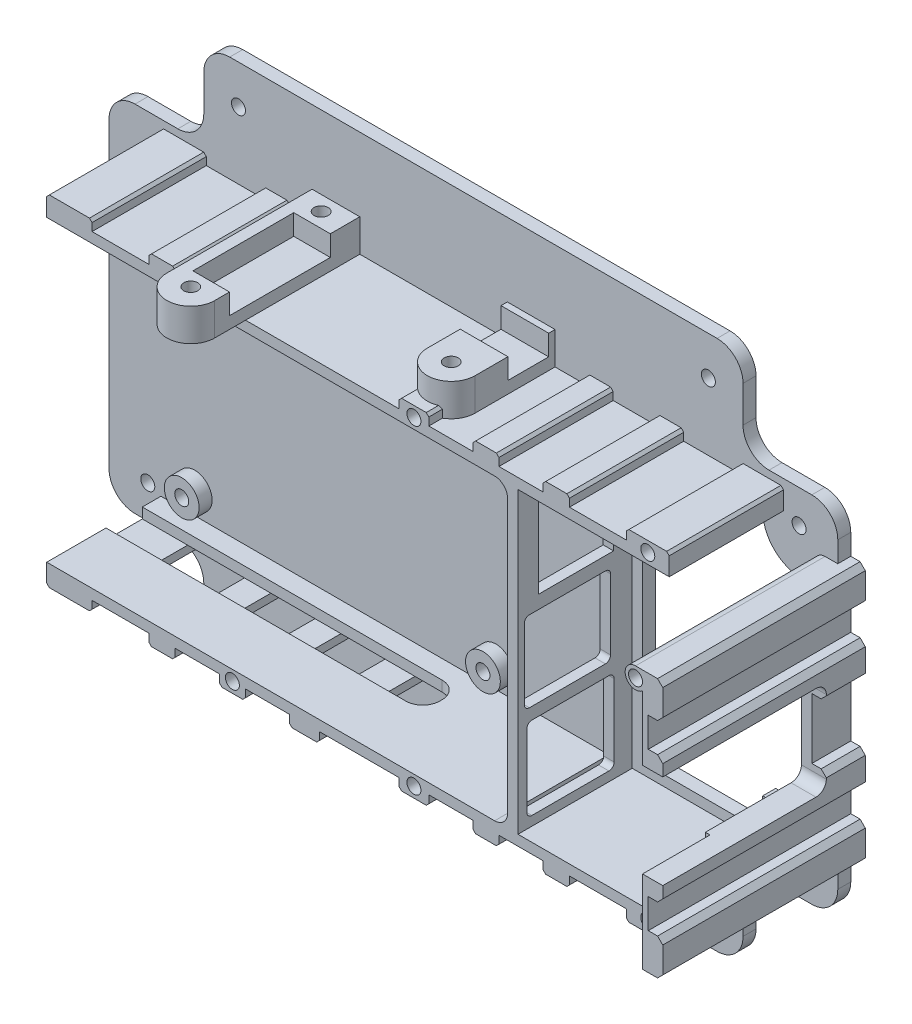
from build123d import *
from build123d.topology import SkipClean

# Parameters (mm, degrees)
SKETCH1_R            = 1.35
BOSS_EXTRUDE1_DEPTH  = 2.5
SKETCH3_R            = 3.35
SKETCH3_R_2          = 1.35
BOSS_EXTRUDE3_DEPTH  = 2.5
CUT_EXTRUDE1_START   = -2.5
SKETCH4_R            = 1.35
CUT_EXTRUDE1_DEPTH   = 2.5
BOSS_EXTRUDE4_DEPTH  = 22
SKETCH6_W            = 14.5
SKETCH6_H            = 16.9
CUT_EXTRUDE2_DEPTH   = 2
CUT_EXTRUDE3_DEPTH   = 2
BOSS_EXTRUDE6_REACH  = 91.556
BOSS_EXTRUDE7_DEPTH  = 1.5
BOSS_EXTRUDE8_DEPTH  = 13
SKETCH12_R           = 1.35
CUT_EXTRUDE4_DEPTH   = 3
SKETCH15_R           = 1.35
BOSS_EXTRUDE9_DEPTH  = 6.25
SKETCH16_W           = 7.045336579
SKETCH16_H           = 19.415
SKETCH16_W_2         = 9.190673157
SKETCH16_H_2         = 7.85
CUT_EXTRUDE5_DEPTH   = 5
SKETCH17_R           = 1.35
CUT_EXTRUDE6_DEPTH   = 3
BOSS_EXTRUDE11_DEPTH = 39
SKETCH19_R           = 1.35
CUT_EXTRUDE8_DEPTH   = 2
CUT_EXTRUDE9_DEPTH   = 2.5
SKETCH22_W           = 8.503871067
SKETCH22_H           = 18.115334786
CUT_EXTRUDE11_DEPTH  = 31.5
FILLET1_R            = 2


with BuildPart() as part:
    # Sketch1 → Boss-Extrude1 (new body)
    with BuildSketch(Plane.XY):
        with BuildLine():
            Line((-70.166987996, -29.147315073), (-70.166987996, 29.147315073))
            ThreePointArc((-70.166987996, 29.147315073), (-68.702521902, 32.682848979), (-65.166987996, 34.147315073))
            Line((-65.166987996, 34.147315073), (-56.919821216, 34.147315073))
            ThreePointArc((-56.919821216, 34.147315073), (-53.38428731, 35.611781167), (-51.919821216, 39.147315073))
            Line((-51.919821216, 39.147315073), (-51.919821216, 46.116987996))
            ThreePointArc((-51.919821216, 46.116987996), (-50.455355122, 49.652521902), (-46.919821216, 51.116987996))
            Line((-46.919821216, 51.116987996), (46.919821216, 51.116987996))
            ThreePointArc((46.919821216, 51.116987996), (50.455355122, 49.652521902), (51.919821216, 46.116987996))
            Line((51.919821216, 46.116987996), (51.919821216, 39.147315073))
            ThreePointArc((51.919821216, 39.147315073), (53.38428731, 35.611781167), (56.919821216, 34.147315073))
            Line((56.919821216, 34.147315073), (65.166987996, 34.147315073))
            ThreePointArc((65.166987996, 34.147315073), (68.702521902, 32.682848979), (70.166987996, 29.147315073))
            Line((70.166987996, 29.147315073), (70.166987996, -29.147315073))
            ThreePointArc((70.166987996, -29.147315073), (68.702521902, -32.682848979), (65.166987996, -34.147315073))
            Line((65.166987996, -34.147315073), (56.919821216, -34.147315073))
            ThreePointArc((56.919821216, -34.147315073), (53.38428731, -35.611781167), (51.919821216, -39.147315073))
            Line((51.919821216, -39.147315073), (51.919821216, -46.116987996))
            ThreePointArc((51.919821216, -46.116987996), (50.455355122, -49.652521902), (46.919821216, -51.116987996))
            Line((46.919821216, -51.116987996), (-46.919821216, -51.116987996))
            ThreePointArc((-46.919821216, -51.116987996), (-50.455355122, -49.652521902), (-51.919821216, -46.116987996))
            Line((-51.919821216, -46.116987996), (-51.919821216, -39.147315073))
            ThreePointArc((-51.919821216, -39.147315073), (-53.38428731, -35.611781167), (-56.919821216, -34.147315073))
            Line((-56.919821216, -34.147315073), (-65.166987996, -34.147315073))
            ThreePointArc((-65.166987996, -34.147315073), (-68.702521902, -32.682848979), (-70.166987996, -29.147315073))
        make_face()
        with Locations((-62.70625, -27.78125)):
            Circle(SKETCH1_R, mode=Mode.SUBTRACT)
        with Locations((-45.24375, -43.65625)):
            Circle(SKETCH1_R, mode=Mode.SUBTRACT)
        with Locations((45.24375, -43.65625)):
            Circle(SKETCH1_R, mode=Mode.SUBTRACT)
        with Locations((62.70625, -27.78125)):
            Circle(SKETCH1_R, mode=Mode.SUBTRACT)
        with Locations((62.70625, 27.78125)):
            Circle(SKETCH1_R, mode=Mode.SUBTRACT)
        with Locations((45.24375, 43.65625)):
            Circle(SKETCH1_R, mode=Mode.SUBTRACT)
        with Locations((-45.24375, 43.65625)):
            Circle(SKETCH1_R, mode=Mode.SUBTRACT)
        with Locations((-62.70625, 27.78125)):
            Circle(SKETCH1_R, mode=Mode.SUBTRACT)
    extrude(amount=BOSS_EXTRUDE1_DEPTH)

    # Sketch3 → Boss-Extrude3 (add)
    # profile 1 of 4: a face of its own
    with BuildSketch(Plane.XY.offset(2.5)):
        with Locations(Location((-53.666987996, 24.5, 0), (0, 0, 180))):
            Circle(SKETCH3_R)
        with Locations((-53.666987996, 24.5)):
            Circle(SKETCH3_R_2, mode=Mode.SUBTRACT)
    # profile 2 of 4: a face of its own
    with BuildSketch(Plane.XY.offset(2.5)):
        with Locations(Location((-53.666987996, -24.5, 0), (0, 0, 180))):
            Circle(SKETCH3_R)
        with Locations((-53.666987996, -24.5)):
            Circle(SKETCH3_R_2, mode=Mode.SUBTRACT)
    # profile 3 of 4: a face of its own
    with BuildSketch(Plane.XY.offset(2.5)):
        with Locations(Location((4.333012004, -24.5, 0), (0, 0, 180))):
            Circle(SKETCH3_R)
        with Locations((4.333012004, -24.5)):
            Circle(SKETCH3_R_2, mode=Mode.SUBTRACT)
    # profile 4 of 4: a face of its own
    with BuildSketch(Plane.XY.offset(2.5)):
        with Locations(Location((4.333012004, 24.5, 0), (0, 0, 180))):
            Circle(SKETCH3_R)
        with Locations((4.333012004, 24.5)):
            Circle(SKETCH3_R_2, mode=Mode.SUBTRACT)
    extrude(amount=BOSS_EXTRUDE3_DEPTH)

    # Sketch4 → Cut-Extrude1 (cut)
    with BuildSketch(Plane.XY.offset(2.5).offset(CUT_EXTRUDE1_START)):
        with Locations(Location((-53.666987996, 24.5, 0), (0, 0, 180))):
            Circle(SKETCH4_R)
        with Locations(Location((4.333012004, 24.5, 0), (0, 0, 180))):
            Circle(SKETCH4_R)
        with Locations(Location((-53.666987996, -24.5, 0), (0, 0, 180))):
            Circle(SKETCH4_R)
        with Locations(Location((4.333012004, -24.5, 0), (0, 0, 180))):
            Circle(SKETCH4_R)
    extrude(amount=CUT_EXTRUDE1_DEPTH, mode=Mode.SUBTRACT)

    # Sketch5 → Boss-Extrude4 (add)
    with BuildSketch(Plane.XY.offset(2.5)):
        with BuildLine():
            Line((-60.166987996, 28.75), (26.083012004, 28.75))
            ThreePointArc((26.083012004, 28.75), (27.850778957, 28.017766953), (28.583012004, 26.25))
            Line((28.583012004, 26.25), (28.583012004, -26.25))
            ThreePointArc((28.583012004, -26.25), (27.850778957, -28.017766953), (26.083012004, -28.75))
            Line((26.083012004, -28.75), (-60.166987996, -28.75))
            Line((-60.166987996, -28.75), (-60.166987996, -30.75))
            Line((-60.166987996, -30.75), (28.083012004, -30.75))
            Line((28.083012004, -30.75), (59.70625, -30.75))
            Line((59.70625, -30.75), (59.70625, -24.78125))
            Line((59.70625, -24.78125), (70.166987996, -24.78125))
            Line((70.166987996, -24.78125), (70.166987996, 25.15))
            Line((70.166987996, 25.15), (67.716987996, 25.15))
            ThreePointArc((67.716987996, 25.15), (65.729849972, 22.923543662), (68.166987996, 21.201282473))
            Line((68.166987996, 21.201282473), (68.166987996, -22.78125))
            Line((68.166987996, -22.78125), (57.70625, -22.78125))
            Line((57.70625, -22.78125), (57.70625, -28.75))
            Line((57.70625, -28.75), (30.583012004, -28.75))
            Line((30.583012004, -28.75), (30.583012004, 28.75))
            Line((30.583012004, 28.75), (59.70625, 28.75))
            Line((59.70625, 28.75), (59.70625, 30.75))
            Line((59.70625, 30.75), (28.083012004, 30.75))
            Line((28.083012004, 30.75), (-60.166987996, 30.75))
            Line((-60.166987996, 30.75), (-60.166987996, 28.75))
        make_face()
    extrude(amount=BOSS_EXTRUDE4_DEPTH)

    # Sketch6 → Cut-Extrude2 (cut)
    with BuildSketch(Plane(origin=(30.583012004, 0, 0), x_dir=(0, 0, -1), z_dir=(1, 0, 0))):
        with BuildLine():
            Line((-6.99, -11.05), (-21.81, -11.05))
            ThreePointArc((-21.81, -11.05), (-22.517106781, -11.342893219), (-22.81, -12.05))
            Line((-22.81, -12.05), (-22.81, -25.95))
            ThreePointArc((-22.81, -25.95), (-22.517106781, -26.657106781), (-21.81, -26.95))
            Line((-21.81, -26.95), (-6.99, -26.95))
            ThreePointArc((-6.99, -26.95), (-6.282893219, -26.657106781), (-5.99, -25.95))
            Line((-5.99, -25.95), (-5.99, -12.05))
            ThreePointArc((-5.99, -12.05), (-6.282893219, -11.342893219), (-6.99, -11.05))
        make_face()
        with BuildLine():
            Line((-22.29, -8.75), (-7.67, -8.75))
            ThreePointArc((-7.67, -8.75), (-6.962893219, -8.457106781), (-6.67, -7.75))
            Line((-6.67, -7.75), (-6.67, 5.75))
            ThreePointArc((-6.67, 5.75), (-6.962893219, 6.457106781), (-7.67, 6.75))
            Line((-7.67, 6.75), (-22.29, 6.75))
            ThreePointArc((-22.29, 6.75), (-22.997106781, 6.457106781), (-23.29, 5.75))
            Line((-23.29, 5.75), (-23.29, -7.75))
            ThreePointArc((-23.29, -7.75), (-22.997106781, -8.457106781), (-22.29, -8.75))
        make_face()
        with Locations((-13.34, 17.75)):
            Rectangle(SKETCH6_W, SKETCH6_H)
    extrude(amount=-CUT_EXTRUDE2_DEPTH, mode=Mode.SUBTRACT)

    # Sketch8 → Cut-Extrude3 (cut)
    with BuildSketch(Plane.XZ.offset(30.75)):
        with BuildLine():
            Line((-60.166987996, 13.09), (-2.416987996, 13.09))
            ThreePointArc((-2.416987996, 13.09), (-0.118890957, 12.138097039), (0.833012004, 9.84))
            Line((0.833012004, 9.84), (0.833012004, 9.34))
            ThreePointArc((0.833012004, 9.34), (-0.118890957, 7.041902961), (-2.416987996, 6.09))
            Line((-2.416987996, 6.09), (-60.166987996, 6.09))
            Line((-60.166987996, 6.09), (-60.166987996, 13.09))
        make_face()
    extrude(amount=-CUT_EXTRUDE3_DEPTH, mode=Mode.SUBTRACT)

    # Boss-Extrude6: up to this face of the body (flat: up to its plane)
    boss_extrude6_end = Plane(part.part.faces().sort_by_distance((69.608140149, -0.789983763, 24.5))[0])
    # Sketch9 → Boss-Extrude6 (add, up to the picked face)
    with BuildSketch(Plane.XY.offset(2.5), mode=Mode.PRIVATE) as boss_extrude6_sk1:
        Polygon((-40.496987996, -30.75), (-35.416987996, -30.75), (-35.416987996, -32.25), (-35.916987996, -32.75), (-39.996987996, -32.75), (-40.496987996, -32.25), align=None)
    boss_extrude6_tool1 = split(extrude(boss_extrude6_sk1.sketch, amount=BOSS_EXTRUDE6_REACH, mode=Mode.PRIVATE), bisect_by=boss_extrude6_end, keep=Keep.BOTH, mode=Mode.PRIVATE)
    # Sketch9 → Boss-Extrude6 (add, up to the picked face)
    with BuildSketch(Plane.XY.offset(2.5), mode=Mode.PRIVATE) as boss_extrude6_sk2:
        Polygon((-26.916987996, -30.75), (-21.916987996, -30.75), (-21.916987996, -32.25), (-22.416987996, -32.75), (-26.416987996, -32.75), (-26.916987996, -32.25), align=None)
    boss_extrude6_tool2 = split(extrude(boss_extrude6_sk2.sketch, amount=BOSS_EXTRUDE6_REACH, mode=Mode.PRIVATE), bisect_by=boss_extrude6_end, keep=Keep.BOTH, mode=Mode.PRIVATE)
    # Sketch9 → Boss-Extrude6 (add, up to the picked face)
    with BuildSketch(Plane.XY.offset(2.5), mode=Mode.PRIVATE) as boss_extrude6_sk3:
        Polygon((-13.416987996, -30.75), (-7.666987996, -30.75), (-7.666987996, -32.25), (-8.166987996, -32.75), (-12.916987996, -32.75), (-13.416987996, -32.25), align=None)
    boss_extrude6_tool3 = split(extrude(boss_extrude6_sk3.sketch, amount=BOSS_EXTRUDE6_REACH, mode=Mode.PRIVATE), bisect_by=boss_extrude6_end, keep=Keep.BOTH, mode=Mode.PRIVATE)
    # Sketch9 → Boss-Extrude6 (add, up to the picked face)
    with BuildSketch(Plane.XY.offset(2.5), mode=Mode.PRIVATE) as boss_extrude6_sk4:
        Polygon((-51.436987996, -30.75), (-60.163932929, -30.75), (-60.163932929, -32.25), (-59.663932929, -32.75), (-51.936987996, -32.75), (-51.436987996, -32.25), align=None)
    boss_extrude6_tool4 = split(extrude(boss_extrude6_sk4.sketch, amount=BOSS_EXTRUDE6_REACH, mode=Mode.PRIVATE), bisect_by=boss_extrude6_end, keep=Keep.BOTH, mode=Mode.PRIVATE)
    # Sketch9 → Boss-Extrude6 (add, up to the picked face)
    with BuildSketch(Plane.XY.offset(2.5), mode=Mode.PRIVATE) as boss_extrude6_sk5:
        Polygon((-26.416987996, 32.75), (-22.416987996, 32.75), (-21.916987996, 32.25), (-21.916987996, 30.75), (-26.916987996, 30.75), (-26.916987996, 32.25), align=None)
    boss_extrude6_tool5 = split(extrude(boss_extrude6_sk5.sketch, amount=BOSS_EXTRUDE6_REACH, mode=Mode.PRIVATE), bisect_by=boss_extrude6_end, keep=Keep.BOTH, mode=Mode.PRIVATE)
    # Sketch9 → Boss-Extrude6 (add, up to the picked face)
    with BuildSketch(Plane.XY.offset(2.5), mode=Mode.PRIVATE) as boss_extrude6_sk6:
        Polygon((-39.996987996, 32.75), (-35.916987996, 32.75), (-35.416987996, 32.25), (-35.416987996, 30.75), (-40.496987996, 30.75), (-40.496987996, 32.25), align=None)
    boss_extrude6_tool6 = split(extrude(boss_extrude6_sk6.sketch, amount=BOSS_EXTRUDE6_REACH, mode=Mode.PRIVATE), bisect_by=boss_extrude6_end, keep=Keep.BOTH, mode=Mode.PRIVATE)
    # Sketch9 → Boss-Extrude6 (add, up to the picked face)
    with BuildSketch(Plane.XY.offset(2.5), mode=Mode.PRIVATE) as boss_extrude6_sk7:
        Polygon((-51.936987996, 32.75), (-59.663932929, 32.75), (-60.163932929, 32.25), (-60.163932929, 30.75), (-51.436987996, 30.75), (-51.436987996, 32.25), align=None)
    boss_extrude6_tool7 = split(extrude(boss_extrude6_sk7.sketch, amount=BOSS_EXTRUDE6_REACH, mode=Mode.PRIVATE), bisect_by=boss_extrude6_end, keep=Keep.BOTH, mode=Mode.PRIVATE)
    # Sketch9 → Boss-Extrude6 (add, up to the picked face)
    with BuildSketch(Plane.XY.offset(2.5), mode=Mode.PRIVATE) as boss_extrude6_sk8:
        Polygon((51.436987996, 32.25), (51.936987996, 32.75), (59.20625, 32.75), (59.70625, 32.25), (59.70625, 30.75), (51.436987996, 30.75), align=None)
    boss_extrude6_tool8 = split(extrude(boss_extrude6_sk8.sketch, amount=BOSS_EXTRUDE6_REACH, mode=Mode.PRIVATE), bisect_by=boss_extrude6_end, keep=Keep.BOTH, mode=Mode.PRIVATE)
    # Sketch9 → Boss-Extrude6 (add, up to the picked face)
    with BuildSketch(Plane.XY.offset(2.5), mode=Mode.PRIVATE) as boss_extrude6_sk9:
        Polygon((40.496987996, 32.25), (39.996987996, 32.75), (35.916987996, 32.75), (35.416987996, 32.25), (35.416987996, 30.75), (40.496987996, 30.75), align=None)
    boss_extrude6_tool9 = split(extrude(boss_extrude6_sk9.sketch, amount=BOSS_EXTRUDE6_REACH, mode=Mode.PRIVATE), bisect_by=boss_extrude6_end, keep=Keep.BOTH, mode=Mode.PRIVATE)
    # Sketch9 → Boss-Extrude6 (add, up to the picked face)
    with BuildSketch(Plane.XY.offset(2.5), mode=Mode.PRIVATE) as boss_extrude6_sk10:
        Polygon((26.916987996, 32.25), (26.416987996, 32.75), (22.416987996, 32.75), (21.916987996, 32.25), (21.916987996, 30.75), (26.916987996, 30.75), align=None)
    boss_extrude6_tool10 = split(extrude(boss_extrude6_sk10.sketch, amount=BOSS_EXTRUDE6_REACH, mode=Mode.PRIVATE), bisect_by=boss_extrude6_end, keep=Keep.BOTH, mode=Mode.PRIVATE)
    # Sketch9 → Boss-Extrude6 (add, up to the picked face)
    with BuildSketch(Plane.XY.offset(2.5), mode=Mode.PRIVATE) as boss_extrude6_sk11:
        Polygon((13.416987996, 32.25), (12.916987996, 32.75), (8.166987996, 32.75), (7.666987996, 32.25), (7.666987996, 30.75), (13.416987996, 30.75), align=None)
    boss_extrude6_tool11 = split(extrude(boss_extrude6_sk11.sketch, amount=BOSS_EXTRUDE6_REACH, mode=Mode.PRIVATE), bisect_by=boss_extrude6_end, keep=Keep.BOTH, mode=Mode.PRIVATE)
    # Sketch9 → Boss-Extrude6 (add, up to the picked face)
    with BuildSketch(Plane.XY.offset(2.5), mode=Mode.PRIVATE) as boss_extrude6_sk12:
        Polygon((12.916987996, -32.75), (8.166987996, -32.75), (7.666987996, -32.25), (7.666987996, -30.75), (13.416987996, -30.75), (13.416987996, -32.25), align=None)
    boss_extrude6_tool12 = split(extrude(boss_extrude6_sk12.sketch, amount=BOSS_EXTRUDE6_REACH, mode=Mode.PRIVATE), bisect_by=boss_extrude6_end, keep=Keep.BOTH, mode=Mode.PRIVATE)
    # Sketch9 → Boss-Extrude6 (add, up to the picked face)
    with BuildSketch(Plane.XY.offset(2.5), mode=Mode.PRIVATE) as boss_extrude6_sk13:
        Polygon((26.416987996, -32.75), (22.416987996, -32.75), (21.916987996, -32.25), (21.916987996, -30.75), (26.916987996, -30.75), (26.916987996, -32.25), align=None)
    boss_extrude6_tool13 = split(extrude(boss_extrude6_sk13.sketch, amount=BOSS_EXTRUDE6_REACH, mode=Mode.PRIVATE), bisect_by=boss_extrude6_end, keep=Keep.BOTH, mode=Mode.PRIVATE)
    # Sketch9 → Boss-Extrude6 (add, up to the picked face)
    with BuildSketch(Plane.XY.offset(2.5), mode=Mode.PRIVATE) as boss_extrude6_sk14:
        Polygon((39.996987996, -32.75), (35.916987996, -32.75), (35.416987996, -32.25), (35.416987996, -30.75), (40.496987996, -30.75), (40.496987996, -32.25), align=None)
    boss_extrude6_tool14 = split(extrude(boss_extrude6_sk14.sketch, amount=BOSS_EXTRUDE6_REACH, mode=Mode.PRIVATE), bisect_by=boss_extrude6_end, keep=Keep.BOTH, mode=Mode.PRIVATE)
    # Sketch9 → Boss-Extrude6 (add, up to the picked face)
    with BuildSketch(Plane.XY.offset(2.5), mode=Mode.PRIVATE) as boss_extrude6_sk15:
        Polygon((51.936987996, -32.75), (59.20625, -32.75), (59.70625, -32.25), (59.70625, -30.75), (51.436987996, -30.75), (51.436987996, -32.25), align=None)
    boss_extrude6_tool15 = split(extrude(boss_extrude6_sk15.sketch, amount=BOSS_EXTRUDE6_REACH, mode=Mode.PRIVATE), bisect_by=boss_extrude6_end, keep=Keep.BOTH, mode=Mode.PRIVATE)
    add(boss_extrude6_tool1.solids().sort_by(Axis((-37.956988, -31.728977, 2.5), (0, 0, 1)))[0])
    add(boss_extrude6_tool2.solids().sort_by(Axis((-24.416988, -31.728632, 2.5), (0, 0, 1)))[0])
    add(boss_extrude6_tool3.solids().sort_by(Axis((-10.541988, -31.731481, 2.5), (0, 0, 1)))[0])
    add(boss_extrude6_tool4.solids().sort_by(Axis((-55.80046, -31.73789, 2.5), (0, 0, 1)))[0])
    add(boss_extrude6_tool5.solids().sort_by(Axis((-24.416988, 31.728632, 2.5), (0, 0, 1)))[0])
    add(boss_extrude6_tool6.solids().sort_by(Axis((-37.956988, 31.728977, 2.5), (0, 0, 1)))[0])
    add(boss_extrude6_tool7.solids().sort_by(Axis((-55.80046, 31.73789, 2.5), (0, 0, 1)))[0])
    add(boss_extrude6_tool8.solids().sort_by(Axis((55.571619, 31.73721, 2.5), (0, 0, 1)))[0])
    add(boss_extrude6_tool9.solids().sort_by(Axis((37.956988, 31.728977, 2.5), (0, 0, 1)))[0])
    add(boss_extrude6_tool10.solids().sort_by(Axis((24.416988, 31.728632, 2.5), (0, 0, 1)))[0])
    add(boss_extrude6_tool11.solids().sort_by(Axis((10.541988, 31.731481, 2.5), (0, 0, 1)))[0])
    add(boss_extrude6_tool12.solids().sort_by(Axis((10.541988, -31.731481, 2.5), (0, 0, 1)))[0])
    add(boss_extrude6_tool13.solids().sort_by(Axis((24.416988, -31.728632, 2.5), (0, 0, 1)))[0])
    add(boss_extrude6_tool14.solids().sort_by(Axis((37.956988, -31.728977, 2.5), (0, 0, 1)))[0])
    add(boss_extrude6_tool15.solids().sort_by(Axis((55.571619, -31.73721, 2.5), (0, 0, 1)))[0])

    # Sketch10 → Boss-Extrude7 (add)
    with SkipClean():  # the faces are left unmerged after this step: merging them gives an invalid solid
        with BuildSketch(Plane.XY.offset(24.5)):
            with BuildLine():
                Line((59.70625, -22.78125), (68.166987996, -22.78125))
                Line((68.166987996, -22.78125), (68.166987996, 21.201282473))
                ThreePointArc((68.166987996, 21.201282473), (65.729849972, 22.923543662), (67.716987996, 25.15))
                Line((67.716987996, 25.15), (70.166987996, 25.15))
                Line((70.166987996, 25.15), (70.166987996, -22.78125))
                Line((70.166987996, -22.78125), (70.166987996, -24.78125))
                Line((70.166987996, -24.78125), (59.70625, -24.78125))
                Line((59.70625, -24.78125), (59.70625, -22.78125))
            make_face()
        extrude(amount=BOSS_EXTRUDE7_DEPTH)
    add(part.part.scale(1), mode=Mode.REPLACE)  # the faces are merged on a copy

    # Sketch11 → Boss-Extrude8 (add)
    with BuildSketch(Plane.XY.offset(26)):
        with BuildLine():
            Line((70.166987996, 25.15), (70.166987996, -24.78125))
            Line((70.166987996, -24.78125), (69.066987996, -24.78125))
            Line((69.066987996, -24.78125), (69.066987996, 21.674364544))
            ThreePointArc((69.066987996, 21.674364544), (65.852682373, 22.425869802), (67.716987996, 25.15))
            Line((67.716987996, 25.15), (70.166987996, 25.15))
        make_face()
    extrude(amount=BOSS_EXTRUDE8_DEPTH)

    # Sketch12 → Cut-Extrude4 (cut)
    with BuildSketch(Plane.XY.offset(39)):
        with Locations((67.716987996, 23.15)):
            Circle(SKETCH12_R)
    extrude(amount=-CUT_EXTRUDE4_DEPTH, mode=Mode.SUBTRACT)

    # Sketch15 → Boss-Extrude9 (add)
    # profile 1 of 2: a face of its own
    with BuildSketch(Plane(origin=(0, 30.75, 0), x_dir=(1, 0, 0), z_dir=(0, 1, 0))):
        with BuildLine():
            Line((6.530747652, -17.9), (6.530747652, -2.5))
            Line((6.530747652, -2.5), (15.721420809, -2.5))
            Line((15.721420809, -2.5), (15.721420809, -17.9))
            ThreePointArc((15.721420809, -17.9), (11.12608423, -22.495336578), (6.530747652, -17.9))
        make_face()
        with Locations(Location((11.12608423, -17.9, 0), (0, 0, 90))):
            Circle(SKETCH15_R, mode=Mode.SUBTRACT)
    # profile 2 of 2: a face of its own
    with BuildSketch(Plane(origin=(0, 30.75, 0), x_dir=(1, 0, 0), z_dir=(0, 1, 0))):
        with BuildLine():
            Line((-21.878579191, -30.45), (-21.878579191, -2.5))
            Line((-21.878579191, -2.5), (-31.069252348, -2.5))
            Line((-31.069252348, -2.5), (-31.069252348, -30.45))
            ThreePointArc((-31.069252348, -30.45), (-26.47391577, -35.045336578), (-21.878579191, -30.45))
        make_face()
        with Locations(Location((-26.47391577, -5.35, 0), (0, 0, 87.583193618))):
            Circle(SKETCH15_R, mode=Mode.SUBTRACT)
        with Locations(Location((-26.47391577, -30.45, 0), (0, 0, 270))):
            Circle(SKETCH15_R, mode=Mode.SUBTRACT)
    extrude(amount=BOSS_EXTRUDE9_DEPTH)

    # Sketch16 → Cut-Extrude5 (cut)
    with BuildSketch(Plane(origin=(0, 38.05, 0), x_dir=(1, 0, 0), z_dir=(0, 1, 0))):
        with Locations((-25.401247481, -17.881473305)):
            Rectangle(SKETCH16_W, SKETCH16_H)
        with Locations((11.126084231, -7.65)):
            Rectangle(SKETCH16_W_2, SKETCH16_H_2)
    extrude(amount=-CUT_EXTRUDE5_DEPTH, mode=Mode.SUBTRACT)

    # Sketch17 → Cut-Extrude6 (cut)
    with BuildSketch(Plane.XY.offset(24.5)):
        with Locations((55.571618998, -30.75)):
            Circle(SKETCH17_R)
        with Locations((10.541987996, -30.75)):
            Circle(SKETCH17_R)
        with Locations((10.545756529, 30.750001775)):
            Circle(SKETCH17_R)
        with Locations((55.575387531, 30.750001775)):
            Circle(SKETCH17_R)
        with Locations((-24.416987996, -30.75)):
            Circle(SKETCH17_R)
    extrude(amount=-CUT_EXTRUDE6_DEPTH, mode=Mode.SUBTRACT)

    # Sketch20 → Boss-Extrude11 (add)
    with BuildSketch(Plane.XY.offset(39)):
        Polygon((70.166987996, 25.15), (71.959982522, 25.15), (72.959982522, 24.15), (72.959982522, 19.15), (71.959982522, 18.15), (70.166987996, 18.15), align=None)
        Polygon((70.166987996, 12.465980753), (71.959982522, 12.465980753), (72.959982522, 11.465980753), (72.959982522, 7.018104034), (71.959982522, 6.018104034), (70.166987996, 6.018104034), align=None)
        Polygon((70.166987996, -12.097230753), (70.166987996, -5.649354034), (71.959982522, -5.649354034), (72.959982522, -6.649354034), (72.959982522, -11.097230753), (71.959982522, -12.097230753), align=None)
        Polygon((70.166987996, -24.78125), (71.959982522, -24.78125), (72.959982522, -23.78125), (72.959982522, -18.78125), (71.959982522, -17.78125), (70.166987996, -17.78125), align=None)
    extrude(amount=-BOSS_EXTRUDE11_DEPTH)

    # Sketch19 → Cut-Extrude8 (cut)
    with BuildSketch(Plane(origin=(0, 0, 0), x_dir=(-1, 0, 0), z_dir=(0, 0, -1))):
        with Locations((0.166987996, -29)):
            Circle(SKETCH19_R)
        with Locations((0.166987996, 29)):
            Circle(SKETCH19_R)
        with Locations((49.166987996, -29)):
            Circle(SKETCH19_R)
        with Locations((49.166987996, 29)):
            Circle(SKETCH19_R)
    extrude(amount=-CUT_EXTRUDE8_DEPTH, mode=Mode.SUBTRACT)

    # Sketch21 → Cut-Extrude9 (cut)
    with BuildSketch(Plane.XY.offset(2.5)):
        with BuildLine():
            Line((32.583012004, 26.75), (55.70625, 26.75))
            ThreePointArc((55.70625, 26.75), (57.917218174, 21.412250647), (63.254967527, 19.201282473))
            Line((63.254967527, 19.201282473), (66.166987996, 19.201282473))
            Line((66.166987996, 19.201282473), (66.166987996, -20.78125))
            Line((66.166987996, -20.78125), (55.70625, -20.78125))
            Line((55.70625, -20.78125), (55.70625, -26.75))
            Line((55.70625, -26.75), (32.583012004, -26.75))
            Line((32.583012004, -26.75), (32.583012004, 26.75))
        make_face()
    extrude(amount=-CUT_EXTRUDE9_DEPTH, mode=Mode.SUBTRACT)

    # Sketch22 → Cut-Extrude11 (cut)
    with BuildSketch(Plane.XY.offset(39)):
        with Locations((68.708046989, 0.184375)):
            Rectangle(SKETCH22_W, SKETCH22_H)
    extrude(amount=-CUT_EXTRUDE11_DEPTH, mode=Mode.SUBTRACT)

    # Fillet1
    fillet1_edges = [part.edges().sort_by_distance(p)[0] for p in [
        (70.563485259, 9.242042393, 7.5),
        (70.563485259, -8.873292393, 7.5),
    ]]
    fillet(fillet1_edges, radius=FILLET1_R)


solid = part.part
